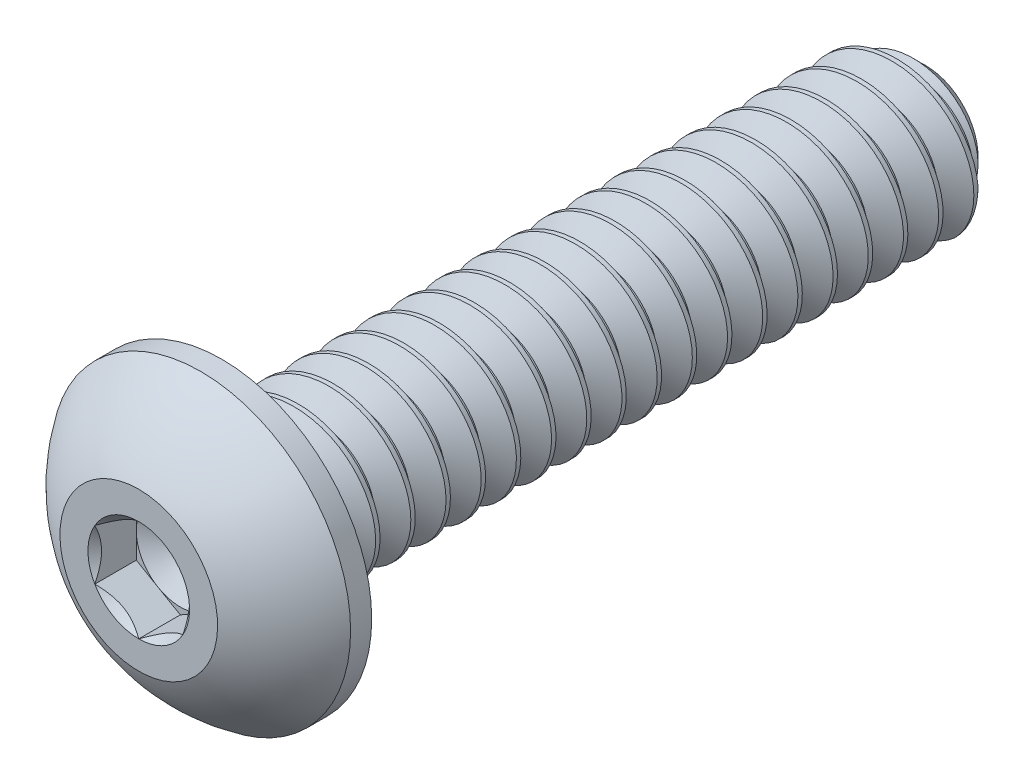
from build123d import *

# Parameters (mm, degrees)
SKETCH1_W          = 12.7
SKETCH1_H          = 1.4224
CHAMFER1_SIZE      = 0.47625
CUT_SWEEP1_PITCH   = 0.635
SKETCH4_R          = 2.7051
EXTRUDE1_DEPTH     = 1.4986
CUT_EXTRUDE1_DEPTH = 0.7493
SKETCH7_R          = 0.916543552
CUT_EXTRUDE4_DEPTH = 0.7493
CUT_EXTRUDE4_DRAFT = -45
SKETCH8_R          = 0.79375
CUT_EXTRUDE5_DEPTH = 0.249766667
CUT_EXTRUDE5_DRAFT = -60


with BuildPart() as part:
    # Sketch1 → Revolve1 (revolve)
    with BuildSketch(Plane(origin=(0, 0, 0), x_dir=(0, 0, -1), z_dir=(1, 0, 0))):
        with Locations((6.35, 0.7112)):
            Rectangle(SKETCH1_W, SKETCH1_H)
    revolve(axis=Axis((0, 0, 0), (0, 0, 1)))

    # Chamfer1
    chamfer1_edges = [part.edges().sort_by_distance(p)[0] for p in [
        (0, -1.4224, -12.7),
    ]]
    chamfer(chamfer1_edges, length=CHAMFER1_SIZE)

    # Cut-Sweep1: arcs per turn and ends read off the stored shape
    # Cut-Sweep1: the profile of Sketch10 profile screwed along a right-hand helix through 25 turns, 6 arcs to a turn; built about Z, then put on its axis
    cut_sweep1_z = Axis((0, 0, 0), (0, 0, 1))
    cut_sweep1_corners = [(1.4227, 0, -0.079201795), (1.4227, 0, -0.635173205), (1.009955401, 0, -0.396875), (1.009955401, 0, -0.3175)]
    with BuildLine(mode=Mode.PRIVATE) as cut_sweep1_profile:
        Line(cut_sweep1_corners[0], cut_sweep1_corners[1])
        Line(cut_sweep1_corners[1], cut_sweep1_corners[2])
        Line(cut_sweep1_corners[2], cut_sweep1_corners[3])
        Line(cut_sweep1_corners[3], cut_sweep1_corners[0])
    cut_sweep1_cap = Face(cut_sweep1_profile.wire())
    cut_sweep1_turn_angles = [0, 30, 60, 90, 120, 150, 180, 210, 240, 270, 300, 330, 360]
    cut_sweep1_turn_weights = [1, 0.8660254037844387, 1, 0.8660254037844387, 1, 0.8660254037844387, 1, 0.8660254037844387, 1, 0.8660254037844387, 1, 0.8660254037844387, 1]
    cut_sweep1_turn_rails = [Edge.make_bspline([Vector(p[0], p[1], 0).rotate(cut_sweep1_z, cut_sweep1_turn_angles[k]) / cut_sweep1_turn_weights[k] + Vector(0, 0, p[2] + CUT_SWEEP1_PITCH * cut_sweep1_turn_angles[k] / 360) for k in range(13)], [0, 0, 0, 1, 1, 2, 2, 3, 3, 4, 4, 5, 5, 6, 6, 6], 2, cut_sweep1_turn_weights) for p in cut_sweep1_corners]
    cut_sweep1_turn_sides = [Face.make_surface_from_curves(cut_sweep1_turn_rails[p[0]], cut_sweep1_turn_rails[p[1]]) for p in [(0, 1), (1, 2), (2, 3), (3, 0)]]
    cut_sweep1 = Plane(origin=(0, 0, -12.7), x_dir=(0.7071067811865488, 0.7071067811865464, 0), z_dir=(0, 0, 1)) * Solid(Shell([*[p.moved(Location((0, 0, CUT_SWEEP1_PITCH * i))) for i in range(25) for p in cut_sweep1_turn_sides], cut_sweep1_cap, cut_sweep1_cap.rotate(cut_sweep1_z, 9000).moved(Location((0, 0, CUT_SWEEP1_PITCH * 9000 / 360)))]))
    add(cut_sweep1, mode=Mode.SUBTRACT)

    # Sketch4 → Extrude1 (add)
    with BuildSketch(Plane.XY):
        Circle(SKETCH4_R)
    extrude(amount=EXTRUDE1_DEPTH)

    # Sketch9 → Cut-Revolve3 (revolve, cut)
    with BuildSketch(Plane(origin=(0, 0, 0), x_dir=(0, 0, -1), z_dir=(1, 0, 0)), mode=Mode.PRIVATE) as cut_revolve3_sk:
        with BuildLine():
            Line((0, 2.7051), (-0.381, 2.7051))
            ThreePointArc((-0.381, 2.7051), (-1.025093234, 2.138064897), (-1.4986, 1.4224))
            Line((-1.4986, 1.4224), (-1.8796, 1.4224))
            Line((-1.8796, 1.4224), (-1.8796, 3.0861))
            Line((-1.8796, 3.0861), (0, 3.0861))
            Line((0, 3.0861), (0, 2.7051))
        make_face()
    revolve(cut_revolve3_sk.sketch.rotate(Axis((0, 0, 0), (0, 0, 1)), 170.90536533), axis=Axis((0, 0, 0), (0, 0, 1)), mode=Mode.SUBTRACT)

    # Sketch6 → Cut-Extrude1 (cut)
    with BuildSketch(Plane.XY.offset(1.4986)):
        Polygon((0, -0.916543552), (0.79375, -0.458271776), (0.79375, 0.458271776), (0, 0.916543552), (-0.79375, 0.458271776), (-0.79375, -0.458271776), align=None)
    extrude(amount=-CUT_EXTRUDE1_DEPTH, mode=Mode.SUBTRACT)


with BuildPart() as cut_extrude4_tool:
    # Sketch7 → Cut-Extrude4 (with draft: the straight prism first)
    with BuildSketch(Plane.XY.offset(1.4986)):
        Circle(SKETCH7_R)
    extrude(amount=-CUT_EXTRUDE4_DEPTH)
    # Cut-Extrude4: the draft: its side faces are tilted about the plane it starts from
    cut_extrude4_sides = [cut_extrude4_tool.faces().sort_by_distance(p)[0] for p in [
        (-0.916543552, 0, 1.12395),
    ]]
    draft(cut_extrude4_sides, Plane.XY.offset(1.4986), CUT_EXTRUDE4_DRAFT)


with BuildPart() as part_1:
    add(part.part)

    # Cut-Extrude4: cut by cut_extrude4_tool
    add(cut_extrude4_tool.part, mode=Mode.SUBTRACT)


with BuildPart() as cut_extrude5_tool:
    # Sketch8 → Cut-Extrude5 (with draft: the straight prism first)
    with BuildSketch(Plane.XY.offset(0.7493)):
        Circle(SKETCH8_R)
    extrude(amount=-CUT_EXTRUDE5_DEPTH)
    # Cut-Extrude5: the draft: its side faces are tilted about the plane it starts from
    cut_extrude5_sides = [cut_extrude5_tool.faces().sort_by_distance(p)[0] for p in [
        (-0.79375, 0, 0.624416667),
    ]]
    draft(cut_extrude5_sides, Plane.XY.offset(0.7493), CUT_EXTRUDE5_DRAFT)


with BuildPart() as part_2:
    add(part_1.part)

    # Cut-Extrude5: cut by cut_extrude5_tool
    add(cut_extrude5_tool.part, mode=Mode.SUBTRACT)


solid = part_2.part
